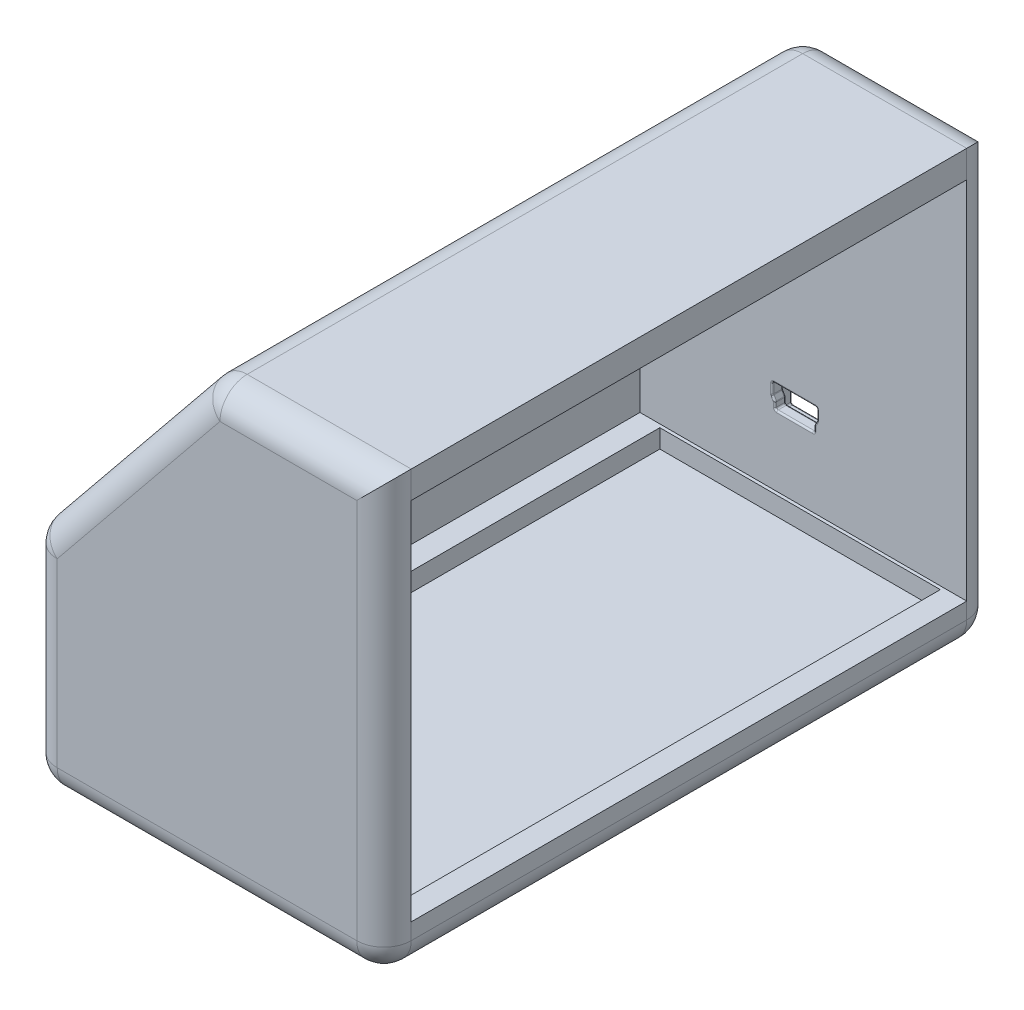
from build123d import *

# Parameters (mm, degrees)
SALIENTE_EXTRUIR1_DEPTH = 112
VACIADO1_START          = 5
VACIADO1_DEPTH          = 102
REDONDEO1_R             = 5
CROQUIS2_W              = 71.4
CROQUIS2_H              = 27
CORTAR_EXTRUIR1_DEPTH   = 10
CORTAR_EXTRUIR2_DEPTH   = 1
CORTAR_EXTRUIR9_DEPTH   = 4
CROQUIS5_R              = 1
CROQUIS5_R_2            = 1.5
CORTAR_EXTRUIR3_DEPTH   = 6
CROQUIS6_W              = 51.5
CROQUIS6_H              = 100.8
CORTAR_EXTRUIR4_DEPTH   = 3.4
CROQUIS7_W              = 7.2
CROQUIS7_H              = 1.2
CORTAR_EXTRUIR6_DEPTH   = 119.765525301
CROQUIS14_W             = 11
CROQUIS14_H             = 9
CORTAR_EXTRUIR11_DEPTH  = 3
REDONDEO2_R             = 0.3


# Read off the part's stored shape, not the designer's step: Vaciado1
with BuildPart() as part:
    # Croquis1 → Saliente-Extruir1 (new body)
    with BuildSketch(Plane.XY):
        Polygon((-32.5, 0), (0, 40), (32.5, 40), (32.5, -40), (-32.5, -40), align=None)
    extrude(amount=SALIENTE_EXTRUIR1_DEPTH)

    # Vaciado1 outline → Vaciado1 (cut)
    with BuildSketch(Plane.XY.offset(VACIADO1_START)):
        Polygon((32.5, 35), (6.245264064, 35), (-27.5, -6.532632694), (-27.5, -32), (32.5, -32), align=None)
    extrude(amount=VACIADO1_DEPTH, mode=Mode.SUBTRACT)

    # Redondeo1
    redondeo1_edges = [part.edges().sort_by_distance(p)[0] for p in [
        (-16.25, 20, 112),
        (-32.5, -20, 112),
        (0, -40, 112),
        (32.5, 0, 112),
        (0, -40, 0),
        (-32.5, -20, 0),
        (-16.25, 20, 0),
        (16.25, 40, 0),
        (32.5, 0, 0),
        (16.25, 40, 112),
        (32.5, -40, 56),
        (-32.5, -40, 56),
        (-32.5, 0, 56),
        (0, 40, 56),
    ]]
    fillet(redondeo1_edges, radius=REDONDEO1_R - 0.0001)  # a hair under: the kernel refuses the full size

    # Croquis2 → Cortar-Extruir1 (cut)
    with BuildSketch(Plane(origin=(-19.576470588, 15.905882353, 0), x_dir=(0, 0, 1), z_dir=(-0.7761140001162655, 0.6305926250944658, 0))):
        with Locations((56, 5.275149845)):
            Rectangle(CROQUIS2_W, CROQUIS2_H)
    extrude(amount=-CORTAR_EXTRUIR1_DEPTH, mode=Mode.SUBTRACT)

    # Croquis3 → Cortar-Extruir2 (cut)
    with BuildSketch(Plane(origin=(-13.367558587, 10.861141352, 0), x_dir=(0, 0, -1), z_dir=(0.7761140001162655, -0.6305926250944659, 0))):
        with BuildLine():
            Line((-97, -11.224850155), (-15, -11.224850155))
            ThreePointArc((-15, -11.224850155), (-12.878679656, -10.346170499), (-12, -8.224850155))
            Line((-12, -8.224850155), (-12, 18.775149845))
            ThreePointArc((-12, 18.775149845), (-12.878679656, 20.896470188), (-15, 21.775149845))
            Line((-15, 21.775149845), (-97, 21.775149845))
            ThreePointArc((-97, 21.775149845), (-99.121320344, 20.896470188), (-100, 18.775149845))
            Line((-100, 18.775149845), (-100, -8.224850155))
            ThreePointArc((-100, -8.224850155), (-99.121320344, -10.346170499), (-97, -11.224850155))
        make_face()
    extrude(amount=-CORTAR_EXTRUIR2_DEPTH, mode=Mode.SUBTRACT)

    # Croquis10 → Cortar-Extruir9 (cut)
    with BuildSketch(Plane(origin=(-14.143672587, 11.491733977, 0), x_dir=(0, 0, -1), z_dir=(0.7761140001162654, -0.630592625094466, 0))):
        Polygon((-91.7, -2.724850155), (-91.7, 13.275149845), (-100, 9.275149845), (-100, 1.275149845), align=None)
    extrude(amount=-CORTAR_EXTRUIR9_DEPTH, mode=Mode.SUBTRACT)

    # Croquis5 → Cortar-Extruir3 (cut)
    with BuildSketch(Plane(origin=(-14.143672587, 11.491733977, 0), x_dir=(0, 0, -1), z_dir=(0.7761140001162655, -0.6305926250944659, 0))):
        with Locations(Location((-96.5, 18.275149845, 0), (0, 0, 90))):
            Circle(CROQUIS5_R)
        with Locations(Location((-96.5, -7.724850155, 0), (0, 0, 90))):
            Circle(CROQUIS5_R_2)
        with Locations(Location((-15.5, -7.724850155, 0), (0, 0, 90))):
            Circle(CROQUIS5_R)
        with Locations(Location((-15.5, 18.275149845, 0), (0, 0, 90))):
            Circle(CROQUIS5_R_2)
    extrude(amount=-CORTAR_EXTRUIR3_DEPTH, mode=Mode.SUBTRACT)

    # Croquis6 → Cortar-Extruir4 (cut)
    with BuildSketch(Plane(origin=(0, -32, 0), x_dir=(1, 0, 0), z_dir=(0, 1, 0))):
        with Locations((2.5, -56)):
            Rectangle(CROQUIS6_W, CROQUIS6_H)
    extrude(amount=-CORTAR_EXTRUIR4_DEPTH, mode=Mode.SUBTRACT)

    # Croquis7 → Cortar-Extruir6 (cut, through all)
    with BuildSketch(Plane.XY.offset(5)):
        Polygon((-2.7, -18), (4.5, -18), (5, -17.1), (5, -15), (-3.2, -15), (-3.2, -17.1), align=None)
        with Locations((0.9, -18.6)):
            Rectangle(CROQUIS7_W, CROQUIS7_H)
    extrude(amount=-CORTAR_EXTRUIR6_DEPTH, mode=Mode.SUBTRACT)

    # Croquis14 → Cortar-Extruir11 (cut)
    with BuildSketch(Plane(origin=(0, 0, 0), x_dir=(-1, 0, 0), z_dir=(0, 0, -1))):
        with Locations((-0.9, -17.1)):
            Rectangle(CROQUIS14_W, CROQUIS14_H)
    extrude(amount=-CORTAR_EXTRUIR11_DEPTH, mode=Mode.SUBTRACT)

    # Redondeo2
    redondeo2_edges = [part.edges().sort_by_distance(p)[0] for p in [
        (-2.95, -17.55, 5),
        (-3.2, -16.05, 5),
        (0.9, -15, 5),
        (-2.7, -18.6, 5),
        (0.9, -19.2, 5),
        (4.5, -18.6, 5),
        (4.75, -17.55, 5),
        (5, -16.05, 5),
        (-2.7, -19.2, 4),
        (-2.7, -18, 4),
        (-2.7, -18.6, 3),
        (4.5, -19.2, 4),
        (4.5, -18, 4),
        (5, -17.1, 4),
        (5, -15, 4),
        (-3.2, -15, 4),
        (-3.2, -17.1, 4),
        (-3.2, -16.05, 3),
        (-2.95, -17.55, 3),
        (0.9, -15, 3),
        (6.4, -17.1, 3),
        (6.4, -21.6, 1.5),
        (0.9, -12.6, 3),
        (6.4, -12.6, 1.5),
        (-4.6, -17.1, 3),
        (-4.6, -12.6, 1.5),
        (0.9, -21.6, 3),
        (-4.6, -21.6, 1.5),
        (5, -16.05, 3),
        (4.75, -17.55, 3),
        (4.5, -18.6, 3),
        (0.9, -19.2, 3),
        (6.4, -17.1, 0),
        (0.9, -21.6, 0),
        (-4.6, -17.1, 0),
        (0.9, -12.6, 0),
    ]]
    fillet(redondeo2_edges, radius=REDONDEO2_R)


solid = part.part
